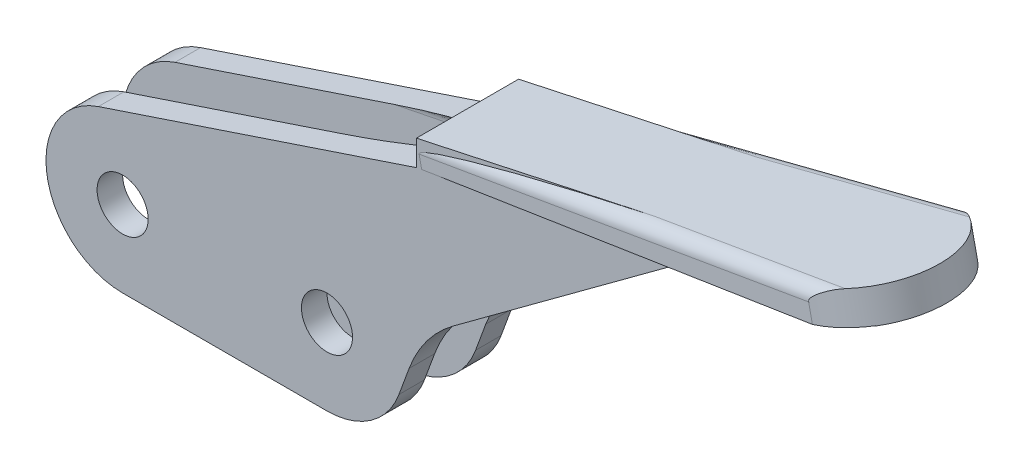
from build123d import *

# Parameters (mm, degrees)
ESQUISSE1_R             = 2
BOSS_EXTRU_1_DEPTH      = 2
BOSS_EXTRU_2_DEPTH      = 2
BOSS_EXTRU_3_REACH      = 67.218
ENL_V_MAT_EXTRU_5_DEPTH = 66.43216575
CONG_1_R                = 1
CONG_2_R                = 1


with BuildPart() as part:
    # Esquisse1 → Boss.-Extru.1 (new body)
    with BuildSketch(Plane.XY):
        with BuildLine():
            Line((0, -6), (16, -6))
            ThreePointArc((16, -6), (19.434160723, -4.920014241), (21.632039887, -2.06884671))
            Line((21.632039887, -2.06884671), (22.429477002, 0.102023476))
            ThreePointArc((22.429477002, 0.102023476), (23.818382286, 2.656840718), (25.883595813, 4.704044206))
            Line((25.883595813, 4.704044206), (43.907312567, 17.986833146))
            Line((43.907312567, 17.986833146), (60.52335338, 21.579490619))
            Line((60.52335338, 21.579490619), (60, 24))
            Line((60, 24), (23, 16))
            Line((23, 16), (23, 14))
            Line((23, 14), (-1.899172411, 5.691497532))
            ThreePointArc((-1.899172411, 5.691497532), (-5.92237221, -0.962032954), (0, -6))
        make_face()
        Circle(ESQUISSE1_R, mode=Mode.SUBTRACT)
        with Locations((16, 0)):
            Circle(ESQUISSE1_R, mode=Mode.SUBTRACT)
    boss_extru_1 = extrude(amount=BOSS_EXTRU_1_DEPTH)

    # Esquisse2 → Boss.-Extru.2 (add)
    with BuildSketch(Plane(origin=(0, 0, 0), x_dir=(-1, 0, 0), z_dir=(0, 0, -1))):
        Polygon((-60.52335338, 21.579490619), (-60, 24), (-23, 16), (-23, 14), align=None)
    boss_extru_2 = extrude(amount=BOSS_EXTRU_2_DEPTH)

    # Symétrie1: Boss.-Extru.1, Boss.-Extru.2 across plane
    add(boss_extru_1.mirror(Plane.XY.offset(-2)))
    add(boss_extru_2.mirror(Plane.XY.offset(-2)))

    # Boss.-Extru.3: up to this plane
    boss_extru_3_end = Plane(origin=(23, 14, -2), z_dir=(-0.19799508496371696, 0.9802030128142897, 0))
    # Esquisse7 → Boss.-Extru.3 (add, up to the surface)
    with BuildSketch(Plane(origin=(-2.277739009, 10.534542917, 0), x_dir=(0.9774141654398673, 0.21133279252753906, 0), z_dir=(-0.21133279252753906, 0.9774141654398673, 0)), mode=Mode.PRIVATE) as boss_extru_3_sk1:
        Polygon((25.861850486, -2), (63.667267202, -3.999795233), (63.716836947, 2), (63.716836947, 8), (25.861850486, 6), align=None)
    boss_extru_3_tool1 = split(extrude(boss_extru_3_sk1.sketch, amount=-BOSS_EXTRU_3_REACH, mode=Mode.PRIVATE), bisect_by=boss_extru_3_end, keep=Keep.BOTH, mode=Mode.PRIVATE)
    add(boss_extru_3_tool1.solids().sort_by_distance((42.727149, 20.265329, -2.000928))[0])

    # Esquisse8 → Enlèv. mat.-Extru.5 (cut, through all)
    with BuildSketch(Plane(origin=(-2.277739009, 10.534542917, 0), x_dir=(0.9774141654398673, 0.21133279252753906, 0), z_dir=(-0.21133279252753906, 0.9774141654398673, 0))):
        with BuildLine():
            Line((57.893179092, 7.823657855), (58.153804594, 10.152084359))
            Line((58.153804594, 10.152084359), (67.029835538, 10.152084359))
            Line((67.029835538, 10.152084359), (67.337455885, -6.822766653))
            Line((67.337455885, -6.822766653), (57.261437216, -6.223219))
            Line((57.261437216, -6.223219), (57.893179092, -3.823657855))
            ThreePointArc((57.893179092, -3.823657855), (63.716836947, 2), (57.893179092, 7.823657855))
        make_face()
    extrude(amount=-ENL_V_MAT_EXTRU_5_DEPTH, mode=Mode.SUBTRACT)

    # Congé1
    cong_1_edges = [part.edges().sort_by_distance(p)[0] for p in [
        (41.588067586, 17.75467732, -4),
        (41.588067586, 17.75467732, 0),
    ]]
    fillet(cong_1_edges, radius=CONG_1_R)

    # Congé2
    # the kernel refuses this fillet: 1 mm, written as the material it takes off along each edge
    with BuildSketch(Plane(origin=(57.690537844, 23.500656831, -7.875164208), x_dir=(0.21133279252753906, -0.9774141654398673, 0), z_dir=(-0.9760528637131802, -0.21103845701906618, 0.05275961425476653))) as cong_2_piece_1_section:
        with BuildLine():
            CenterArc((CONG_2_R, CONG_2_R), CONG_2_R, 180, 90)
            Line((0, CONG_2_R), (0, 0))
            Line((0, 0), (CONG_2_R, 0))
        make_face()
    cong_2_piece_1 = extrude(amount=38.041658791, mode=Mode.PRIVATE)
    cong_2_piece_1 = split(cong_2_piece_1, bisect_by=Plane(origin=(54.069822656, 22.51805355, -6), z_dir=(0, 0, -1)), keep=Keep.TOP, mode=Mode.PRIVATE)
    add(cong_2_piece_1, mode=Mode.SUBTRACT)
    with BuildSketch(Plane(origin=(20.559876055, 15.472405634, 1.867941987), x_dir=(0.2113327925275391, -0.9774141654398673, 0), z_dir=(0.9760495779057013, 0.2110377465742059, 0.05282320504270329))) as cong_2_piece_2_section:
        with BuildLine():
            CenterArc((CONG_2_R, CONG_2_R), CONG_2_R, 180, 90)
            Line((0, CONG_2_R), (0, 0))
            Line((0, 0), (CONG_2_R, 0))
        make_face()
    cong_2_piece_2 = extrude(amount=38.032176769, mode=Mode.PRIVATE)
    cong_2_piece_2 = split(cong_2_piece_2, bisect_by=Plane(origin=(39.441724265, 19.308611578, 2), z_dir=(0, 0, 1)), keep=Keep.TOP, mode=Mode.PRIVATE)
    add(cong_2_piece_2, mode=Mode.SUBTRACT)


solid = part.part
